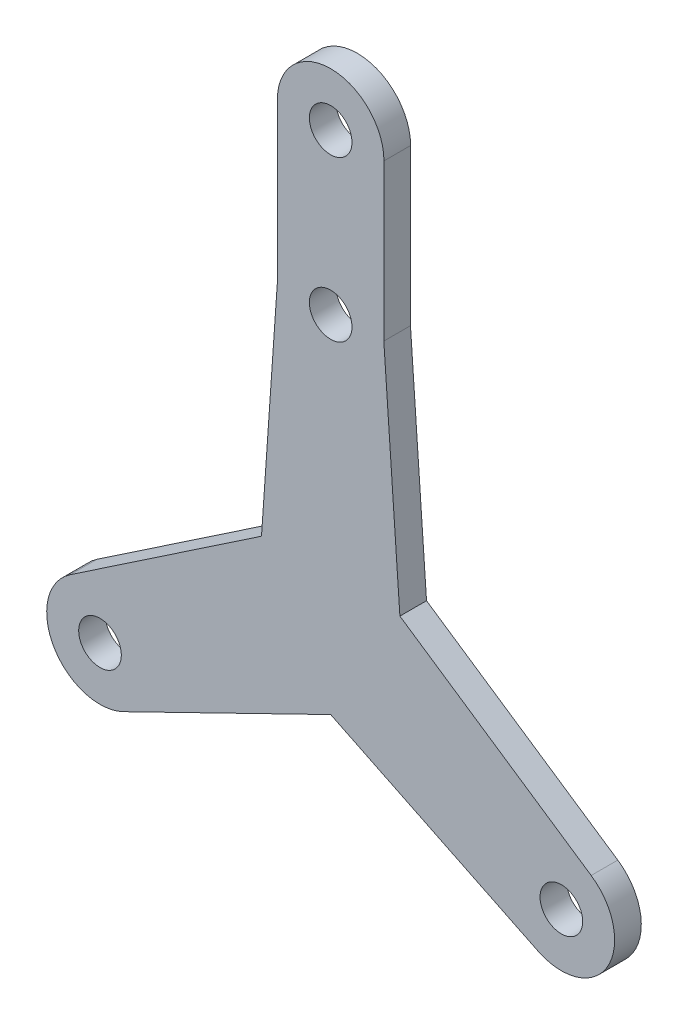
from build123d import *

# Parameters (mm, degrees)
BOSS_EXTRUDE1_DEPTH = 5
SKETCH3_R           = 4
CUT_EXTRUDE1_DEPTH  = 5


with BuildPart() as part:
    # Sketch1 → Boss-Extrude1 (new body)
    with BuildSketch(Plane.XY):
        with BuildLine():
            Line((-38.916331436, -83.987341772), (0, -65))
            Line((0, -65), (38.916331436, -83.987341772))
            ThreePointArc((38.916331436, -83.987341772), (51.961524227, -80), (48.8920671, -66.708860759))
            Line((48.8920671, -66.708860759), (12.990381057, -42.5))
            Line((12.990381057, -42.5), (9.975735664, 0.696202532))
            Line((9.975735664, 0.696202532), (10, 30))
            ThreePointArc((10, 30), (0, 40), (-10, 30))
            Line((-10, 30), (-9.975735664, 0.696202532))
            Line((-9.975735664, 0.696202532), (-12.990381057, -42.5))
            Line((-12.990381057, -42.5), (-48.8920671, -66.708860759))
            ThreePointArc((-48.8920671, -66.708860759), (-51.961524227, -80), (-38.916331436, -83.987341772))
        make_face()
    extrude(amount=BOSS_EXTRUDE1_DEPTH)

    # Sketch3 → Cut-Extrude1 (cut)
    with BuildSketch(Plane(origin=(0, 0, 0), x_dir=(-1, 0, 0), z_dir=(0, 0, -1))):
        with Locations((0, 30)):
            Circle(SKETCH3_R)
        Circle(SKETCH3_R)
        with Locations((-43.301270189, -75)):
            Circle(SKETCH3_R)
        with Locations((43.301270189, -75)):
            Circle(SKETCH3_R)
    extrude(amount=-CUT_EXTRUDE1_DEPTH, mode=Mode.SUBTRACT)


solid = part.part
